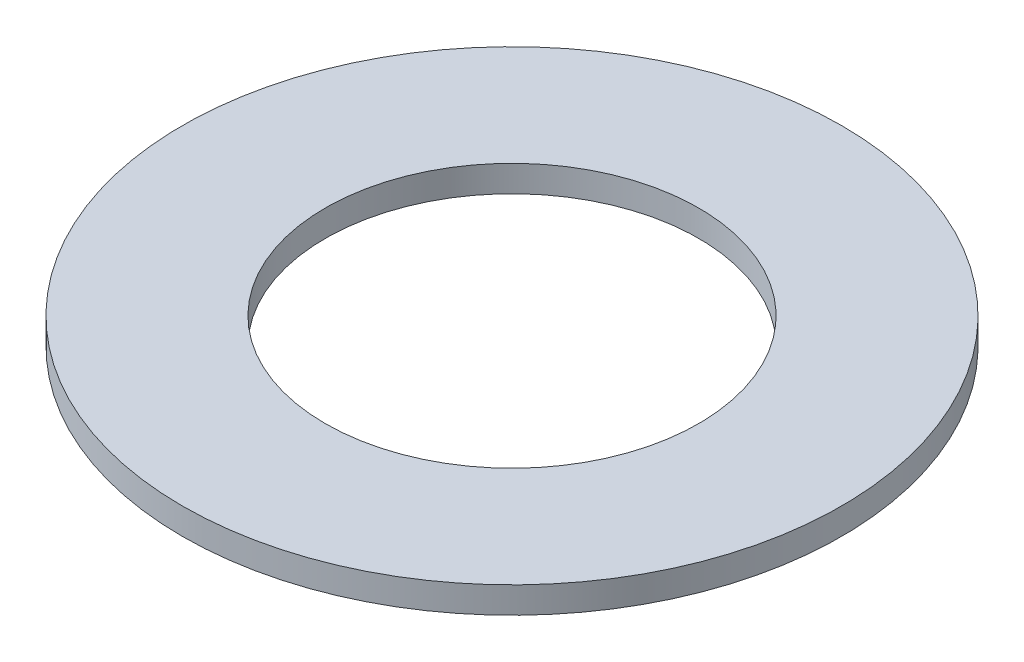
from build123d import *

# Parameters (mm, degrees)
SKETCH1_R           = 75
BOSS_EXTRUDE1_DEPTH = 6
SKETCH2_R           = 42.5
CUT_EXTRUDE1_DEPTH  = 107.235587258


with BuildPart() as part:
    # Sketch1 → Boss-Extrude1 (new body)
    with BuildSketch(Plane(origin=(0, 0, 0), x_dir=(1, 0, 0), z_dir=(0, 1, 0))):
        Circle(SKETCH1_R)
    extrude(amount=BOSS_EXTRUDE1_DEPTH)

    # Sketch2 → Cut-Extrude1 (cut, through all)
    with BuildSketch(Plane(origin=(0, 0, 0), x_dir=(1, 0, 0), z_dir=(0, 1, 0))):
        Circle(SKETCH2_R)
    extrude(amount=CUT_EXTRUDE1_DEPTH, mode=Mode.SUBTRACT)


solid = part.part
